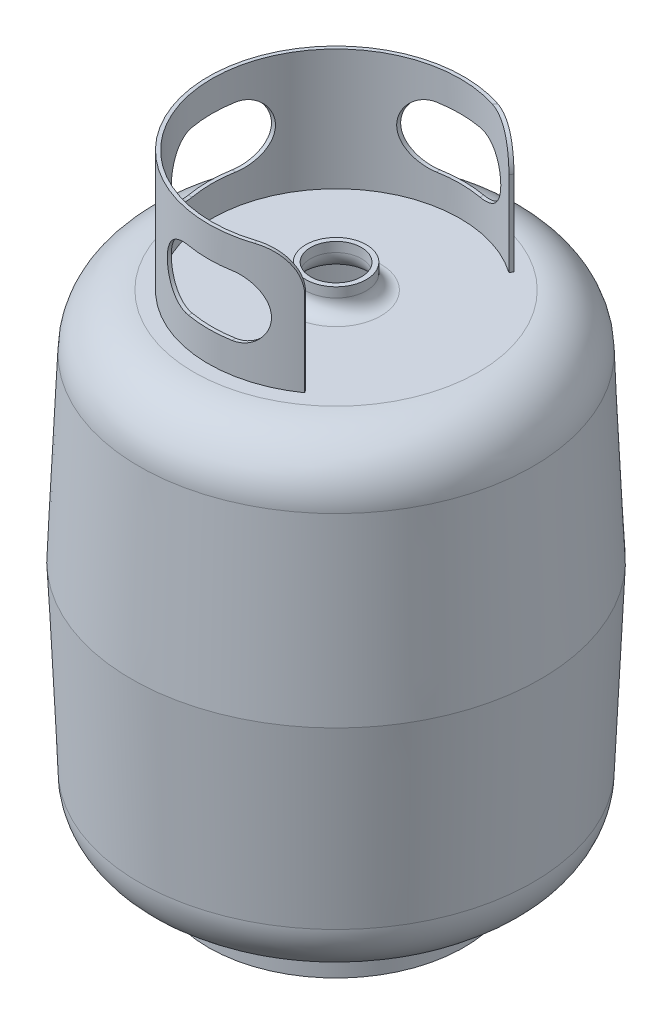
from build123d import *

# Parameters (mm, degrees)
BOSS_EXTRUDE1_DEPTH     = 100
CUT_EXTRUDE1_REACH      = 372.988
CUT_EXTRUDE1_END_RADIUS = 105.5
CIRPATTERN1_COUNT       = 3
CIRPATTERN1_ANGLE       = 180
FILLET1_R               = 30
BOSS_EXTRUDE2_START     = 30
SKETCH4_R               = 105.5
SKETCH4_R_2             = 102.5
BOSS_EXTRUDE2_DEPTH     = 30


with BuildPart() as part:
    # Sketch1 → Revolve1 (revolve)
    with BuildSketch(Plane(origin=(0, 0, 0), x_dir=(0, 0, -1), z_dir=(1, 0, 0)), mode=Mode.PRIVATE) as revolve1_sk:
        with BuildLine():
            Line((-25, 203.75), (-25, 195.75))
            ThreePointArc((-25, 195.75), (-28.514718626, 187.264718626), (-37, 183.75))
            Line((-37, 183.75), (-117.5, 183.75))
            ThreePointArc((-117.5, 183.75), (-149.319805153, 170.569805153), (-162.5, 138.75))
            Line((-162.5, 138.75), (-168.994565258, -10))
            Line((-168.994565258, -10), (-162.5, -158.75))
            ThreePointArc((-162.5, -158.75), (-149.319805153, -190.569805153), (-117.5, -203.75))
            Line((-117.5, -203.75), (0, -203.75))
            Line((0, -203.75), (0, -199.75))
            Line((0, -199.75), (-117.5, -199.75))
            ThreePointArc((-117.5, -199.75), (-146.52150293, -187.711221792), (-158.49991137, -158.664749642))
            Line((-158.49991137, -158.664749642), (-164.990754517, -10))
            Line((-164.990754517, -10), (-158.49991137, 138.664749642))
            ThreePointArc((-158.49991137, 138.664749642), (-146.52150293, 167.711221792), (-117.5, 179.75))
            Line((-117.5, 179.75), (-37, 179.75))
            ThreePointArc((-37, 179.75), (-25.686291501, 184.436291501), (-21, 195.75))
            Line((-21, 195.75), (-21, 203.75))
            Line((-21, 203.75), (-25, 203.75))
        make_face()
    revolve(revolve1_sk.sketch.rotate(Axis((0, -203.75, 0), (0, 1, 0)), 180), axis=Axis((0, -203.75, 0), (0, 1, 0)))

    # Sketch2 → Boss-Extrude1 (add)
    with BuildSketch(Plane(origin=(0, 183.75, 0), x_dir=(1, 0, 0), z_dir=(0, 1, 0))):
        with BuildLine():
            Line((58.791584726, -83.96308454), (60.512314035, -86.420540672))
            ThreePointArc((60.512314035, -86.420540672), (-105.5, 0), (60.512314035, 86.420540672))
            Line((60.512314035, 86.420540672), (58.791584726, 83.96308454))
            ThreePointArc((58.791584726, 83.96308454), (-102.5, 0), (58.791584726, -83.96308454))
        make_face()
    extrude(amount=BOSS_EXTRUDE1_DEPTH)

    # Cut-Extrude1: up to this cylinder (the profile starts inside it)
    cut_extrude1_end = Plane(origin=(0, 233.75, 0), z_dir=(0, -1, 0)) * Cylinder(CUT_EXTRUDE1_END_RADIUS, 957.976, mode=Mode.PRIVATE)
    # Sketch3 → Cut-Extrude1 (cut, up to the surface)
    with BuildSketch(Plane.XY, mode=Mode.PRIVATE) as cut_extrude1_sk1:
        with BuildLine():
            Line((-18, 258.75), (18, 258.75))
            ThreePointArc((18, 258.75), (43, 233.75), (18, 208.75))
            Line((18, 208.75), (-18, 208.75))
            ThreePointArc((-18, 208.75), (-43, 233.75), (-18, 258.75))
        make_face()
    cut_extrude1_tool1 = extrude(cut_extrude1_sk1.sketch, amount=CUT_EXTRUDE1_REACH, mode=Mode.PRIVATE) & cut_extrude1_end
    cut_extrude1 = cut_extrude1_tool1.solids().sort_by_distance((0, 233.75, 0))[0]
    add(cut_extrude1, mode=Mode.SUBTRACT)

    # CirPattern1: Cut-Extrude1 ×3 about axis
    cirpattern1_axis = Axis((0, 283.75, 0), (0, -1, 0))
    for i in range(1, CIRPATTERN1_COUNT):
        add(cut_extrude1.rotate(cirpattern1_axis, i * CIRPATTERN1_ANGLE / (CIRPATTERN1_COUNT - 1)), mode=Mode.SUBTRACT)

    # Fillet1
    # the kernel refuses this fillet: 30 mm, written as the material it takes off along each edge
    with BuildSketch(Plane(origin=(15.773352, 283.75, 22.526681218), x_dir=(0, -1, 0), z_dir=(0.5735764363510389, 0, 0.8191520442889968)), Plane(origin=(103.530546761, 283.75, -147.856943994), x_dir=(0, -1, 0), z_dir=(-0.5735764363510422, 0, 0.8191520442889947))) as fillet1_piece_1:
        with BuildLine():
            CenterArc((FILLET1_R, -FILLET1_R), FILLET1_R, 90, 90)
            Line((0, -FILLET1_R), (0, 0))
            Line((0, 0), (FILLET1_R, 0))
        make_face()
    extrude(amount=153, mode=Mode.SUBTRACT)

    # Sketch4 → Boss-Extrude2 (add)
    with BuildSketch(Plane.XZ.offset(203.75).offset(BOSS_EXTRUDE2_START)):
        with Locations(Location((0, 0, 0), (0, 0, 90))):
            Circle(SKETCH4_R)
        with Locations(Location((0, 0, 0), (0, 0, 90))):
            Circle(SKETCH4_R_2, mode=Mode.SUBTRACT)
    extrude(amount=-BOSS_EXTRUDE2_DEPTH)


solid = part.part
